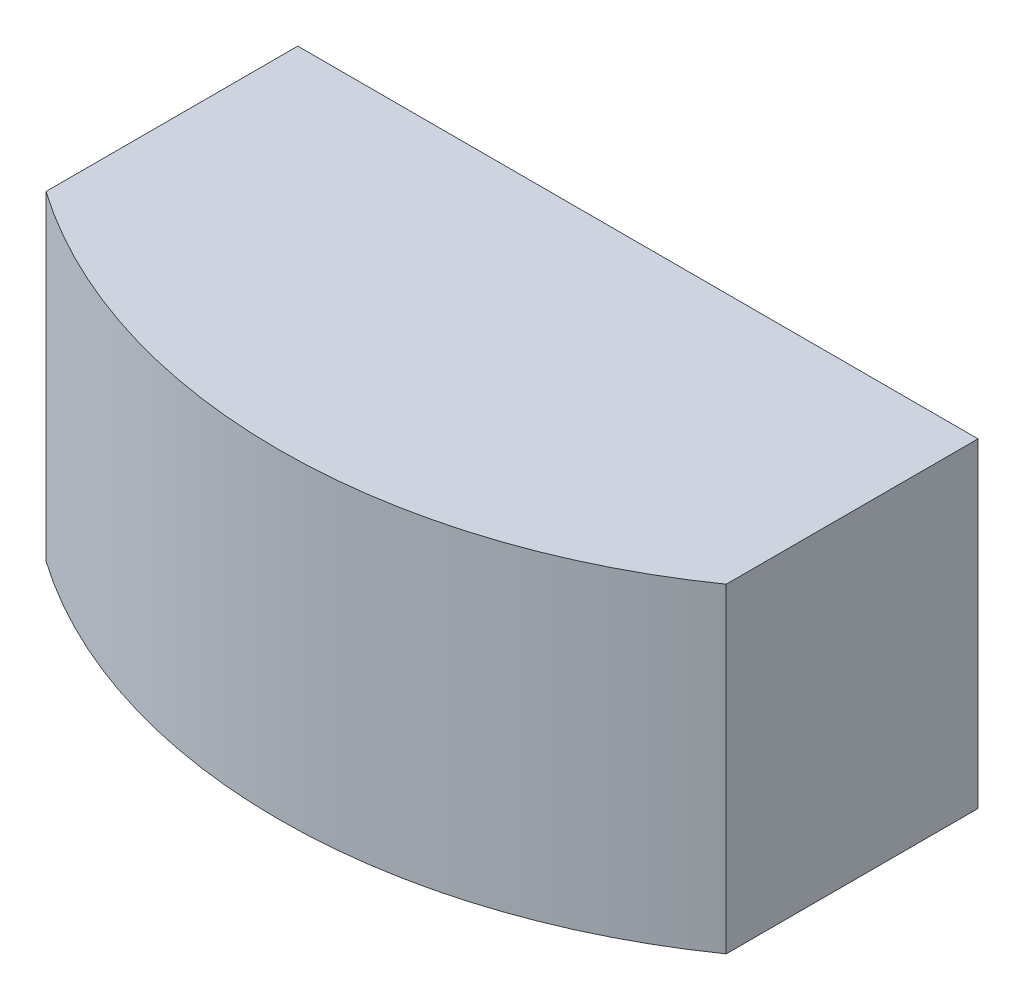
from build123d import *

# Parameters (mm, degrees)
EXTRUDE_START            = -329.393398282
EXTRUDE_1_DEPTH          = 367.123106012
CUT_EXTRUDE_2_REACH      = 654.668
CUT_EXTRUDE_2_END_RADIUS = 675
SKETCH_4_W               = 770
SKETCH_4_H               = 357.123106012
SKETCH_5_RX              = 84.852813742
SKETCH_5_RY              = 60
CUT_EXTRUDE_3_DEPTH      = 10


# Read off the part's stored shape, not the designer's step: 凸台-拉伸1
with BuildPart() as part:
    # 凸台-拉伸1 outline → 凸台-拉伸1 (new body)
    with BuildSketch(Plane(origin=(0, 0, 0), x_dir=(1, 0, 0), z_dir=(0, 1, 0)).offset(EXTRUDE_START)):
        with BuildLine():
            Line((390, -288.70946964), (390, 0))
            Line((390, 0), (-390, 0))
            Line((-390, 0), (-390, -288.70946964))
            ThreePointArc((-390, -288.70946964), (0, -411.663690552), (390, -288.70946964))
        make_face()
    extrude(amount=EXTRUDE_1_DEPTH)

    # 切除-拉伸2: up to this cylinder (the profile starts inside it)
    cut_extrude_2_end = Plane(origin=(0, -145.831845, -268.336309448), z_dir=(0, 1, 0)) * Cylinder(CUT_EXTRUDE_2_END_RADIUS, 2660.336, mode=Mode.PRIVATE)
    # 草图4 → 切除-拉伸2 (cut, up to the surface)
    with BuildSketch(Plane(origin=(0, 0, 5), x_dir=(-1, 0, 0), z_dir=(0, 0, -1)), mode=Mode.PRIVATE) as cut_extrude_2_sk1:
        with Locations((0, -145.831845276)):
            Rectangle(SKETCH_4_W, SKETCH_4_H)
    cut_extrude_2_tool1 = extrude(cut_extrude_2_sk1.sketch, amount=-CUT_EXTRUDE_2_REACH, mode=Mode.PRIVATE) & cut_extrude_2_end
    add(cut_extrude_2_tool1.solids().sort_by_distance((0, -145.831845, 5))[0], mode=Mode.SUBTRACT)

    # 草图5 → 切除-拉伸3 (cut)
    with BuildSketch(Plane(origin=(0, 0, 0), x_dir=(-1, 0, 0), z_dir=(0, 0, -1))):
        with Locations(Location((0, -47.72970773), (0, 0, 90))):
            Ellipse(SKETCH_5_RX, SKETCH_5_RY)
    extrude(amount=-CUT_EXTRUDE_3_DEPTH, mode=Mode.SUBTRACT)


solid = part.part
